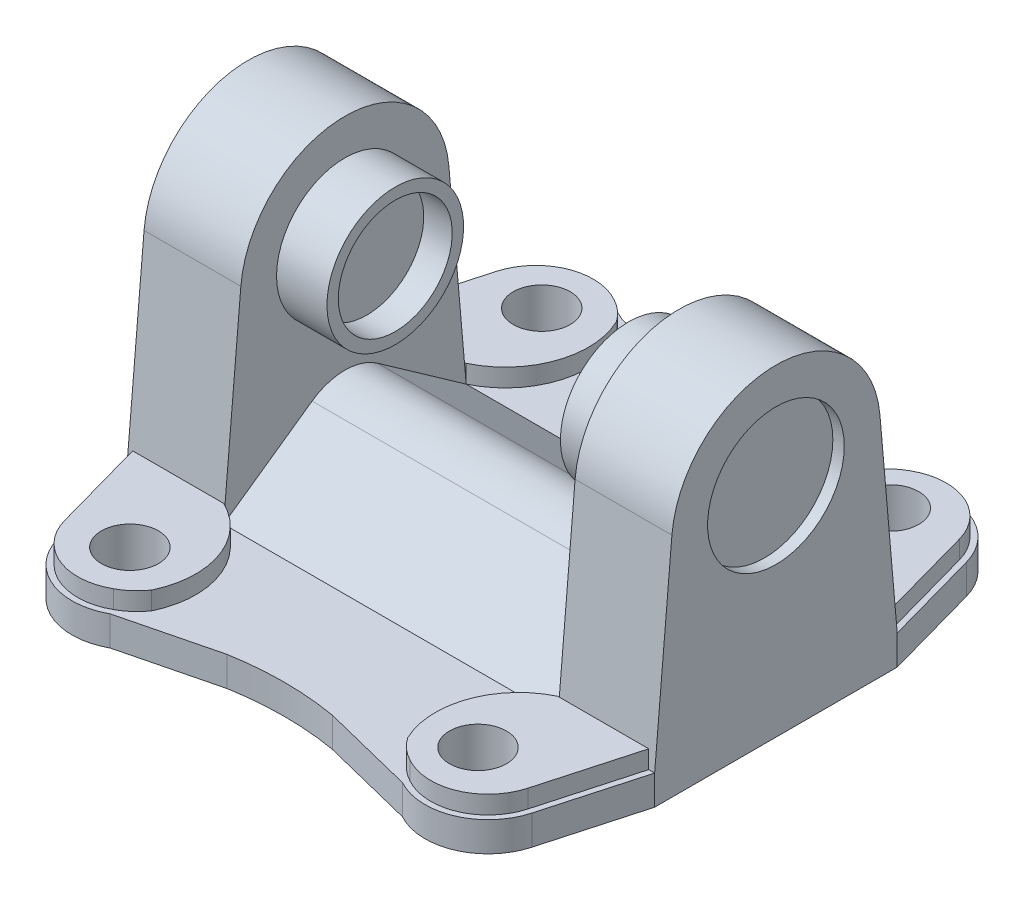
from build123d import *

# Parameters (mm, degrees)
BOSS_EXTRUDE1_DEPTH  = 6.604
MOVE_FACE1_DEPTH     = 6.604
MOVE_FACE1_2_DEPTH   = 6.604
BOSS_EXTRUDE2_DEPTH  = 21.59
BOSS_EXTRUDE3_REACH  = 135.651
FILLET1_R            = 12.7
BOSS_EXTRUDE4_DEPTH  = 4.0259
MIRROR3_COPY_1_DEPTH = 4.0259
SKETCH13_R           = 6.35
CUT_EXTRUDE1_DEPTH   = 110.931012164
SKETCH9_R            = 47.625
SKETCH9_R_2          = 43.434
BOSS_EXTRUDE7_DEPTH  = 1.27
CUT_EXTRUDE2_START   = -5.08
SKETCH15_R           = 43.434
CUT_EXTRUDE2_DEPTH   = 5.08
SKETCH16_R           = 15.24
CUT_EXTRUDE3_DEPTH   = 2.54
SKETCH17_R           = 15.24
BOSS_EXTRUDE8_DEPTH  = 11.2395
SKETCH18_R           = 12.7
CUT_EXTRUDE4_DEPTH   = 6.35


# Read off the part's stored shape, not the designer's step: Move Face1
with BuildPart() as part:
    # Sketch1 → Boss-Extrude1 (new body)
    with BuildSketch(Plane(origin=(0, 0, 0), x_dir=(1, 0, 0), z_dir=(0, 1, 0))):
        with BuildLine():
            Line((0, 27.051), (0, -27.051))
            Line((0, -27.051), (5.969168013, -48.482817353))
            ThreePointArc((5.969168013, -48.482817353), (14.05820124, -57.663213719), (26.276846155, -57.017572631))
            Line((26.276846155, -57.017572631), (47.13309789, -51.810845761))
            ThreePointArc((47.13309789, -51.810845761), (58.8645, -50.8), (70.59590211, -51.810845761))
            Line((70.59590211, -51.810845761), (91.452153845, -57.017572631))
            ThreePointArc((91.452153845, -57.017572631), (103.67079876, -57.663213719), (111.759831987, -48.482817353))
            Line((111.759831987, -48.482817353), (117.729, -27.051))
            Line((117.729, -27.051), (117.729, 27.051))
            Line((117.729, 27.051), (111.759831987, 48.482817353))
            ThreePointArc((111.759831987, 48.482817353), (103.67079876, 57.663213719), (91.452153845, 57.017572631))
            Line((91.452153845, 57.017572631), (70.59590211, 51.810845761))
            ThreePointArc((70.59590211, 51.810845761), (58.8645, 50.8), (47.13309789, 51.810845761))
            Line((47.13309789, 51.810845761), (26.276846155, 57.017572631))
            ThreePointArc((26.276846155, 57.017572631), (14.05820124, 57.663213719), (5.969168013, 48.482817353))
            Line((5.969168013, 48.482817353), (0, 27.051))
        make_face()
    extrude(amount=BOSS_EXTRUDE1_DEPTH)

    # Move Face1 outline → Move Face1 (cut)
    with BuildSketch(Plane(origin=(0, 0, 0), x_dir=(1, 0, 0), z_dir=(0, 1, 0))):
        with BuildLine():
            ThreePointArc((11.73140211, -51.810845761), (9.381670874, -51.444731901), (7.020658859, -51.160305269))
            ThreePointArc((7.020658859, -51.160305269), (15.412744455, -58.152404227), (26.276846155, -57.017572631))
            Line((26.276846155, -57.017572631), (29.43225, -56.229831564))
            Line((29.43225, -56.229831564), (11.73140211, -51.810845761))
        make_face()
        with BuildLine():
            ThreePointArc((26.276846155, 57.017572631), (15.412744455, 58.152404227), (7.020658859, 51.160305269))
            ThreePointArc((7.020658859, 51.160305269), (9.381670874, 51.444731901), (11.73140211, 51.810845761))
            Line((11.73140211, 51.810845761), (29.43225, 56.229831564))
            Line((29.43225, 56.229831564), (26.276846155, 57.017572631))
        make_face()
        with BuildLine():
            ThreePointArc((52.895331987, -48.482817353), (52.438308346, -49.848549416), (51.843841141, -51.160305269))
            ThreePointArc((51.843841141, -51.160305269), (61.242225011, -50.841231235), (70.59590211, -51.810845761))
            Line((70.59590211, -51.810845761), (91.452153845, -57.017572631))
            ThreePointArc((91.452153845, -57.017572631), (103.67079876, -57.663213719), (111.759831987, -48.482817353))
            Line((111.759831987, -48.482817353), (117.729, -27.051))
            Line((117.729, -27.051), (117.729, 27.051))
            Line((117.729, 27.051), (111.759831987, 48.482817353))
            ThreePointArc((111.759831987, 48.482817353), (103.67079876, 57.663213719), (91.452153845, 57.017572631))
            Line((91.452153845, 57.017572631), (70.59590211, 51.810845761))
            ThreePointArc((70.59590211, 51.810845761), (61.242225011, 50.841231235), (51.843841141, 51.160305269))
            ThreePointArc((51.843841141, 51.160305269), (52.438308346, 49.848549416), (52.895331987, 48.482817353))
            Line((52.895331987, 48.482817353), (58.8645, 27.051))
            Line((58.8645, 27.051), (58.8645, -27.051))
            Line((58.8645, -27.051), (52.895331987, -48.482817353))
        make_face()
    extrude(amount=MOVE_FACE1_DEPTH, mode=Mode.SUBTRACT)

    # Move Face1 2 outline → Move Face1 2 (add)
    with BuildSketch(Plane(origin=(0, 0, 0), x_dir=(1, 0, 0), z_dir=(0, 1, 0))):
        with BuildLine():
            Line((-58.8645, -27.051), (-52.895331987, -48.482817353))
            ThreePointArc((-52.895331987, -48.482817353), (-44.80629876, -57.663213719), (-32.587653845, -57.017572631))
            Line((-32.587653845, -57.017572631), (-11.73140211, -51.810845761))
            ThreePointArc((-11.73140211, -51.810845761), (-2.377725011, -50.841231235), (7.020658859, -51.160305269))
            ThreePointArc((7.020658859, -51.160305269), (6.426191654, -49.848549416), (5.969168013, -48.482817353))
            Line((5.969168013, -48.482817353), (0, -27.051))
            Line((0, -27.051), (0, 27.051))
            Line((0, 27.051), (5.969168013, 48.482817353))
            ThreePointArc((5.969168013, 48.482817353), (6.426191654, 49.848549416), (7.020658859, 51.160305269))
            ThreePointArc((7.020658859, 51.160305269), (-2.377725011, 50.841231235), (-11.73140211, 51.810845761))
            Line((-11.73140211, 51.810845761), (-32.587653845, 57.017572631))
            ThreePointArc((-32.587653845, 57.017572631), (-44.80629876, 57.663213719), (-52.895331987, 48.482817353))
            Line((-52.895331987, 48.482817353), (-58.8645, 27.051))
            Line((-58.8645, 27.051), (-58.8645, -27.051))
        make_face()
        with BuildLine():
            Line((47.13309789, -51.810845761), (29.43225, -56.229831564))
            Line((29.43225, -56.229831564), (32.587653845, -57.017572631))
            ThreePointArc((32.587653845, -57.017572631), (43.451755545, -58.152404227), (51.843841141, -51.160305269))
            ThreePointArc((51.843841141, -51.160305269), (49.482829126, -51.444731901), (47.13309789, -51.810845761))
        make_face()
        with BuildLine():
            Line((32.587653845, 57.017572631), (29.43225, 56.229831564))
            Line((29.43225, 56.229831564), (47.13309789, 51.810845761))
            ThreePointArc((47.13309789, 51.810845761), (49.482829126, 51.444731901), (51.843841141, 51.160305269))
            ThreePointArc((51.843841141, 51.160305269), (43.451755545, 58.152404227), (32.587653845, 57.017572631))
        make_face()
    extrude(amount=MOVE_FACE1_2_DEPTH)

    # Sketch5 → Boss-Extrude2 (add)
    with BuildSketch(Plane(origin=(58.8645, 0, 0), x_dir=(0, 0, -1), z_dir=(1, 0, 0))):
        with BuildLine():
            Line((-23.199811166, 50.623289797), (-27.051, 6.604))
            Line((-27.051, 6.604), (27.051, 6.604))
            Line((27.051, 6.604), (23.199811166, 50.623289797))
            ThreePointArc((23.199811166, 50.623289797), (0, 71.882), (-23.199811166, 50.623289797))
        make_face()
    boss_extrude2 = extrude(amount=-BOSS_EXTRUDE2_DEPTH)

    # Mirror1: Boss-Extrude2 across plane
    add(boss_extrude2.mirror(Plane(origin=(0, 0, 0), x_dir=(0, 0, 1), z_dir=(1, 0, 0))))

    # Sketch7 → Boss-Extrude3 (add, up to next)
    with BuildSketch(Plane.ZY.offset(-37.2745), mode=Mode.PRIVATE) as boss_extrude3_sk1:
        Polygon((-27.051, 6.604), (27.051, 6.604), (0, 25.654), align=None)
    boss_extrude3_tool1 = extrude(boss_extrude3_sk1.sketch, amount=BOSS_EXTRUDE3_REACH, mode=Mode.PRIVATE) - part.part
    add(boss_extrude3_tool1.solids().sort_by_distance((37.2745, 12.954, 0))[0])

    # Fillet1
    fillet1_edges = [part.edges().sort_by_distance(p)[0] for p in [
        (0, 25.654, 0),
    ]]
    fillet(fillet1_edges, radius=FILLET1_R)

    # Sketch8 → Boss-Extrude4 (add)
    with BuildSketch(Plane(origin=(0, 6.604, 0), x_dir=(1, 0, 0), z_dir=(0, 1, 0))):
        with BuildLine():
            Line((-57.546161193, -27.051), (-51.671898381, -48.142067867))
            ThreePointArc((-51.671898381, -48.142067867), (-44.239742404, -56.523444134), (-33.059468887, -55.82638267))
            ThreePointArc((-33.059468887, -55.82638267), (-30.556113123, -54.093687416), (-28.541750469, -51.810845761))
            ThreePointArc((-28.541750469, -51.810845761), (-27.780193276, -37.622311234), (-37.2745, -27.051))
            Line((-37.2745, -27.051), (-57.546161193, -27.051))
        make_face()
    boss_extrude4 = extrude(amount=BOSS_EXTRUDE4_DEPTH)

    # Mirror2: Boss-Extrude4 across plane
    add(boss_extrude4.mirror(Plane(origin=(0, 0, 0), x_dir=(0, 0, 1), z_dir=(1, 0, 0))))

    # Mirror3: Boss-Extrude4 across plane
    add(boss_extrude4.mirror(Plane.XY))

    # Mirror3 copy 1 sketch → Mirror3 copy 1 (add)
    with BuildSketch(Plane(origin=(0, 6.604, 0), x_dir=(-1, 0, 0), z_dir=(0, 1, 0))):
        with BuildLine():
            Line((-57.546161193, -27.051), (-51.671898381, -48.142067867))
            ThreePointArc((-51.671898381, -48.142067867), (-44.239742404, -56.523444134), (-33.059468887, -55.82638267))
            ThreePointArc((-33.059468887, -55.82638267), (-30.556113123, -54.093687416), (-28.541750469, -51.810845761))
            ThreePointArc((-28.541750469, -51.810845761), (-27.780193276, -37.622311234), (-37.2745, -27.051))
            Line((-37.2745, -27.051), (-57.546161193, -27.051))
        make_face()
    extrude(amount=MIRROR3_COPY_1_DEPTH)

    # Sketch13 → Cut-Extrude1 (cut, through all)
    with BuildSketch(Plane(origin=(0, 0, 0), x_dir=(-1, 0, 0), z_dir=(0, -1, 0))):
        with Locations(Location((39.240708081, -45.97811401, 0), (0, 0, 90))):
            Circle(SKETCH13_R)
        with Locations(Location((-38.229291919, -45.81936236, 0), (0, 0, 90))):
            Circle(SKETCH13_R)
        with Locations(Location((-37.975496477, 46.39533764, 0), (0, 0, 90))):
            Circle(SKETCH13_R)
        with Locations(Location((39.494503523, 46.12740723, 0), (0, 0, 90))):
            Circle(SKETCH13_R)
    extrude(amount=-CUT_EXTRUDE1_DEPTH, mode=Mode.SUBTRACT)

    # Sketch9 → Boss-Extrude7 (add)
    with BuildSketch(Plane.XZ):
        with Locations(Location((0, 0, 0), (0, 0, 90))):
            Circle(SKETCH9_R)
        with Locations(Location((0, 0, 0), (0, 0, 270))):
            Circle(SKETCH9_R_2, mode=Mode.SUBTRACT)
    extrude(amount=BOSS_EXTRUDE7_DEPTH)

    # Sketch15 → Cut-Extrude2 (cut)
    with BuildSketch(Plane.XZ.offset(CUT_EXTRUDE2_START)):
        with Locations(Location((0, 0, 0), (0, 0, 270))):
            Circle(SKETCH15_R)
    extrude(amount=CUT_EXTRUDE2_DEPTH, mode=Mode.SUBTRACT)

    # Sketch16 → Cut-Extrude3 (cut)
    with BuildSketch(Plane(origin=(58.8645, 0, 0), x_dir=(0, 0, -1), z_dir=(1, 0, 0))):
        with Locations((0, 48.593569324)):
            Circle(SKETCH16_R)
    cut_extrude3 = extrude(amount=-CUT_EXTRUDE3_DEPTH, mode=Mode.SUBTRACT)

    # Sketch17 → Boss-Extrude8 (add)
    with BuildSketch(Plane.ZY.offset(-37.2745)):
        with Locations(Location((0, 48.593569324, 0), (0, 0, 180))):
            Circle(SKETCH17_R)
    boss_extrude8 = extrude(amount=BOSS_EXTRUDE8_DEPTH)

    # Sketch18 → Cut-Extrude4 (cut)
    with BuildSketch(Plane.ZY.offset(-26.035)):
        with Locations((0, 48.593569324)):
            Circle(SKETCH18_R)
    cut_extrude4 = extrude(amount=-CUT_EXTRUDE4_DEPTH, mode=Mode.SUBTRACT)

    # Mirror4: Cut-Extrude3, Boss-Extrude8, Cut-Extrude4 across plane
    add(cut_extrude3.mirror(Plane(origin=(0, 0, 0), x_dir=(0, 0, 1), z_dir=(1, 0, 0))), mode=Mode.SUBTRACT)
    add(boss_extrude8.mirror(Plane(origin=(0, 0, 0), x_dir=(0, 0, 1), z_dir=(1, 0, 0))))
    add(cut_extrude4.mirror(Plane(origin=(0, 0, 0), x_dir=(0, 0, 1), z_dir=(1, 0, 0))), mode=Mode.SUBTRACT)


solid = part.part
